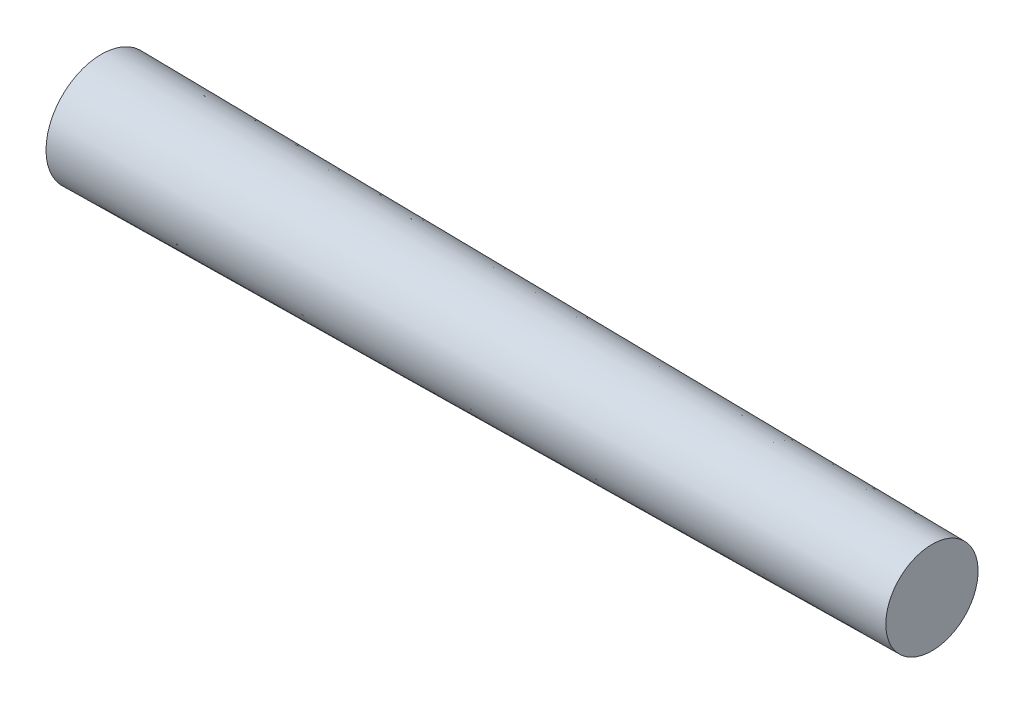
from build123d import *


with BuildPart() as part:
    # Sketch1 → Revolve1 (revolve)
    with BuildSketch(Plane.XY):
        Polygon((0, 0), (0, 3), (45, 2.5), (45, 0), align=None)
    revolve(axis=Axis((0, 0, 0), (1, 0, 0)))


solid = part.part
